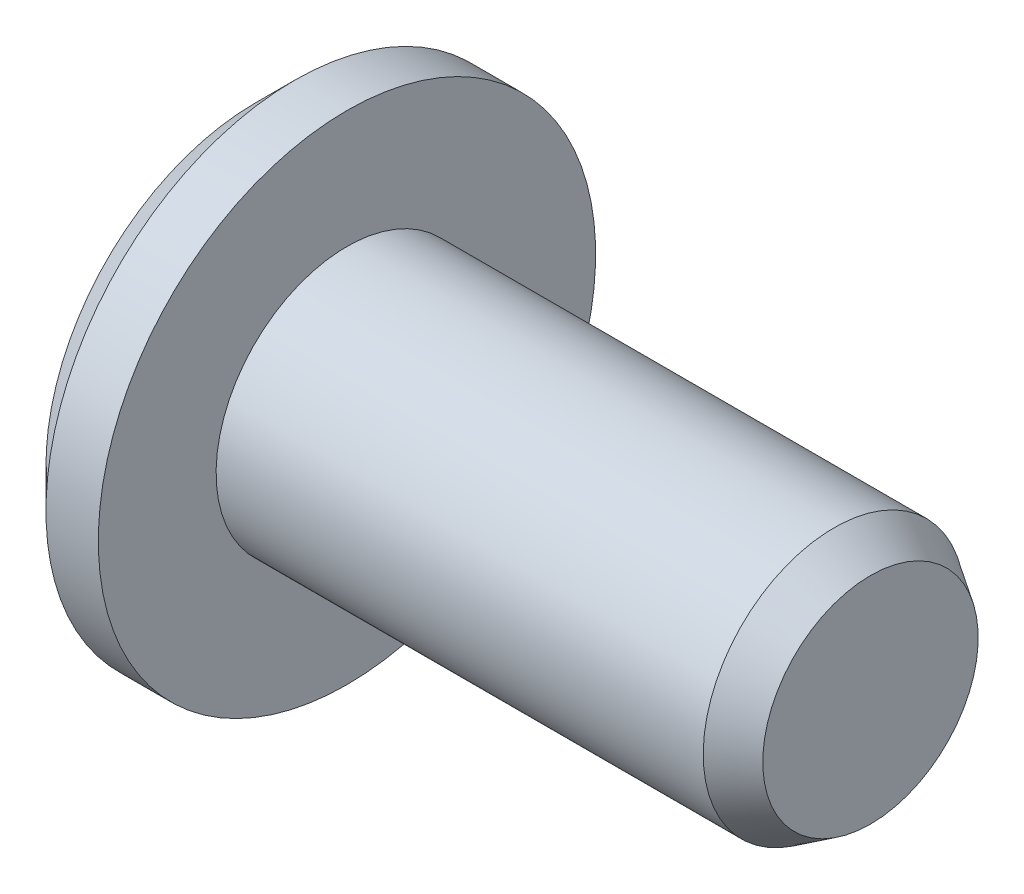
from build123d import *

# Parameters (mm, degrees)
CUT_EXTRUDE1_DEPTH = 1
CHAMFER1_SIZE      = 0.75


with BuildPart() as part:
    # Sketch1 → Revolve1 (revolve)
    with BuildSketch(Plane.XY):
        Polygon((11.75, 0), (11.75, 2.057236169), (11.055, 2.5), (1.75, 2.5), (1.75, 4.75), (0, 4.75), (0, 0), align=None)
    revolve(axis=Axis((0, 0, 0), (1, 0, 0)))

    # Sketch5 → Cut-Extrude1 (cut)
    with BuildSketch(Plane.ZY):
        Polygon((1.5, -0.866025404), (1.5, 0.866025404), (0, 1.732050808), (-1.5, 0.866025404), (-1.5, -0.866025404), (0, -1.732050808), align=None)
    extrude(amount=-CUT_EXTRUDE1_DEPTH, mode=Mode.SUBTRACT)

    # Chamfer1
    chamfer1_edges = [part.edges().sort_by_distance(p)[0] for p in [
        (0, -4.75, 0),
    ]]
    chamfer(chamfer1_edges, length=CHAMFER1_SIZE)


solid = part.part
